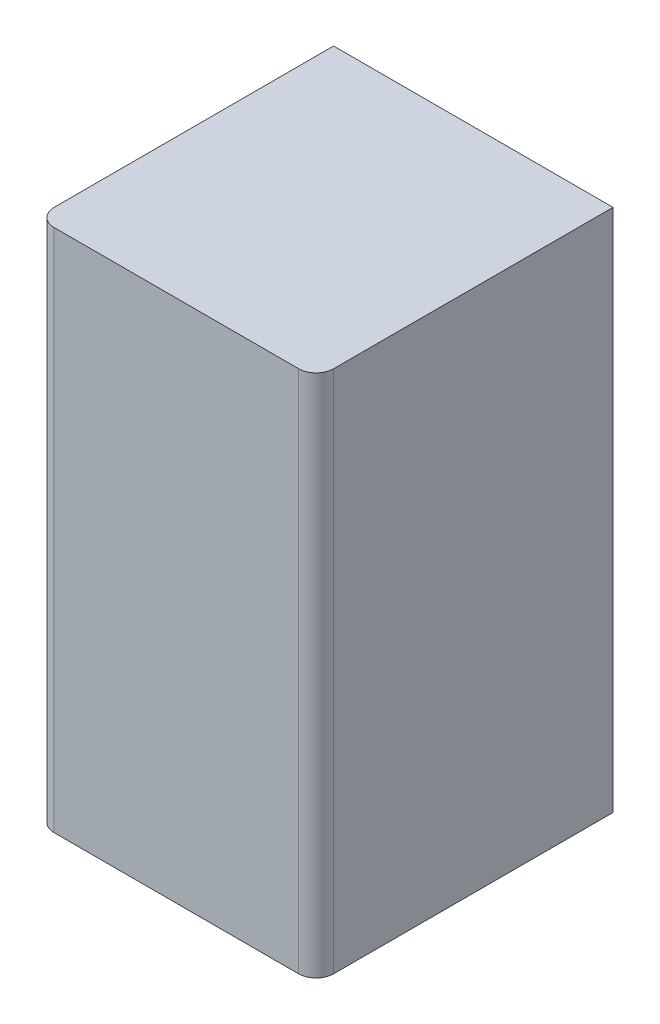
from build123d import *

# Parameters (mm, degrees)
SKETCH_1_W      = 16
SKETCH_1_H      = 30
EXTRUDE_1_DEPTH = 0.1
SKETCH_2_W      = 16
SKETCH_2_H      = 30
EXTRUDE_2_DEPTH = 16.9
FILLET_1_R      = 1


with BuildPart() as part:
    # 草图1 → 拉伸1 (new body)
    with BuildSketch(Plane.XY):
        Rectangle(SKETCH_1_W, SKETCH_1_H)
    extrude(amount=EXTRUDE_1_DEPTH)

    # 草图2 → 拉伸2 (add)
    with BuildSketch(Plane.XY.offset(0.1)):
        Rectangle(SKETCH_2_W, SKETCH_2_H)
    extrude(amount=EXTRUDE_2_DEPTH)

    # 圆角1
    fillet_1_edges = [part.edges().sort_by_distance(p)[0] for p in [
        (-8, 0, 17),
        (8, 0, 17),
    ]]
    fillet(fillet_1_edges, radius=FILLET_1_R)


solid = part.part
